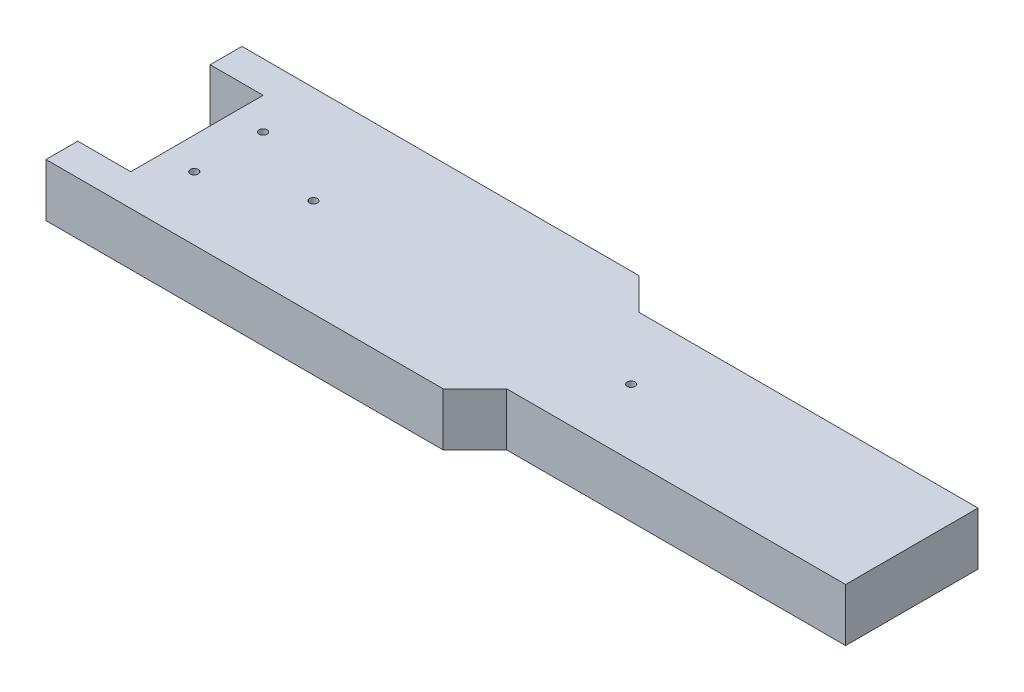
from build123d import *

# Parameters (mm, degrees)
EXTRUDE_1_DEPTH        = 10
SKETCH_2_R             = 0.75
CUT_EXTRUDE_1_DEPTH    = 149.613592918
PATTERN_LINEAR_1_COUNT = 2
PATTERN_LINEAR_1_PITCH = 60
SKETCH_3_R             = 0.75
CUT_EXTRUDE_2_DEPTH    = 149.613592918


with BuildPart() as part:
    # Эскиз1 → Бобышка-Вытянуть1 (new body)
    with BuildSketch(Plane(origin=(0, 0, 0), x_dir=(1, 0, 0), z_dir=(0, 1, 0))):
        Polygon((0, 31), (75, 31), (81, 25), (145, 25), (145, 0), (81, 0), (75, -6), (0, -6), (0, 0), (10, 0), (10, 25), (0, 25), align=None)
    extrude(amount=EXTRUDE_1_DEPTH)

    # Эскиз2 → Вырез-Вытянуть1 (cut, through all)
    with BuildSketch(Plane(origin=(0, 10, 0), x_dir=(1, 0, 0), z_dir=(0, 1, 0))):
        with Locations((32, 12.5)):
            Circle(SKETCH_2_R)
    cut_extrude_1 = extrude(amount=-CUT_EXTRUDE_1_DEPTH, mode=Mode.SUBTRACT)

    # Линейный массив1: Вырез-Вытянуть1 ×2
    with Locations(*[(i * PATTERN_LINEAR_1_PITCH, 0, 0) for i in range(1, PATTERN_LINEAR_1_COUNT)]):
        add(cut_extrude_1, mode=Mode.SUBTRACT)

    # Эскиз3 → Вырез-Вытянуть2 (cut, through all)
    with BuildSketch(Plane(origin=(0, 10, 0), x_dir=(1, 0, 0), z_dir=(0, 1, 0))):
        with Locations((16, 6)):
            Circle(SKETCH_3_R)
        with Locations((16, 19)):
            Circle(SKETCH_3_R)
    extrude(amount=-CUT_EXTRUDE_2_DEPTH, mode=Mode.SUBTRACT)


solid = part.part
